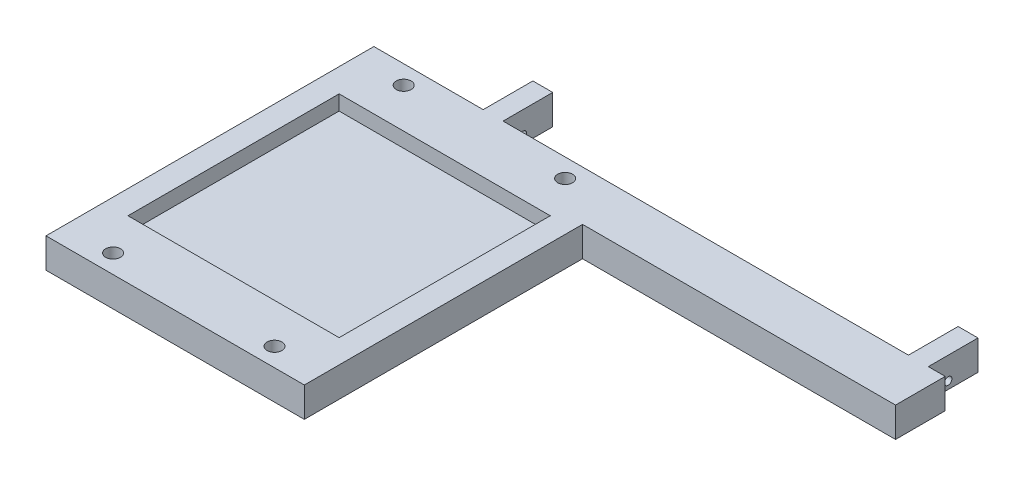
from build123d import *

# Parameters (mm, degrees)
SKETCH1_W           = 52
SKETCH1_H           = 66
BOSS_EXTRUDE1_DEPTH = 6
SKETCH2_W           = 42.5
SKETCH2_H           = 42.5
CUT_EXTRUDE1_DEPTH  = 3
SKETCH3_R           = 1.5
CUT_EXTRUDE2_DEPTH  = 13
SKETCH4_W           = 10
SKETCH4_H           = 6
BOSS_EXTRUDE2_DEPTH = 63
SKETCH5_W           = 4
SKETCH5_H           = 6
BOSS_EXTRUDE3_DEPTH = 10
SKETCH6_R           = 0.75
CUT_EXTRUDE3_DEPTH  = 114


with BuildPart() as part:
    # Sketch1 → Boss-Extrude1 (new body)
    with BuildSketch(Plane(origin=(0, 0, 0), x_dir=(1, 0, 0), z_dir=(0, 1, 0))):
        with Locations((-26, -33)):
            Rectangle(SKETCH1_W, SKETCH1_H)
    extrude(amount=BOSS_EXTRUDE1_DEPTH)

    # Sketch2 → Cut-Extrude1 (cut)
    with BuildSketch(Plane(origin=(0, 6, 0), x_dir=(1, 0, 0), z_dir=(0, 1, 0))):
        with Locations((-26, -33)):
            Rectangle(SKETCH2_W, SKETCH2_H)
    extrude(amount=-CUT_EXTRUDE1_DEPTH, mode=Mode.SUBTRACT)

    # Sketch3 → Cut-Extrude2 (cut)
    with BuildSketch(Plane(origin=(0, 6, 0), x_dir=(1, 0, 0), z_dir=(0, 1, 0))):
        with Locations((-42.25, -3.75)):
            Circle(SKETCH3_R)
        with Locations((-9.75, -3.75)):
            Circle(SKETCH3_R)
        with Locations((-9.75, -62.25)):
            Circle(SKETCH3_R)
        with Locations((-42.25, -62.25)):
            Circle(SKETCH3_R)
    extrude(amount=-CUT_EXTRUDE2_DEPTH, mode=Mode.SUBTRACT)

    # Sketch4 → Boss-Extrude2 (add)
    with BuildSketch(Plane(origin=(0, 0, 0), x_dir=(0, 0, -1), z_dir=(1, 0, 0))):
        with Locations((-5, 3)):
            Rectangle(SKETCH4_W, SKETCH4_H)
    extrude(amount=BOSS_EXTRUDE2_DEPTH)

    # Sketch5 → Boss-Extrude3 (add)
    with BuildSketch(Plane(origin=(0, 0, 0), x_dir=(-1, 0, 0), z_dir=(0, 0, -1))):
        with Locations((28, 3)):
            Rectangle(SKETCH5_W, SKETCH5_H)
        with Locations((-57.6, 3)):
            Rectangle(SKETCH5_W, SKETCH5_H)
    extrude(amount=BOSS_EXTRUDE3_DEPTH)

    # Sketch6 → Cut-Extrude3 (cut)
    with BuildSketch(Plane(origin=(59.6, 0, 0), x_dir=(0, 0, -1), z_dir=(1, 0, 0))):
        with Locations((4, 1.5)):
            Circle(SKETCH6_R)
    extrude(amount=-CUT_EXTRUDE3_DEPTH, mode=Mode.SUBTRACT)


solid = part.part
